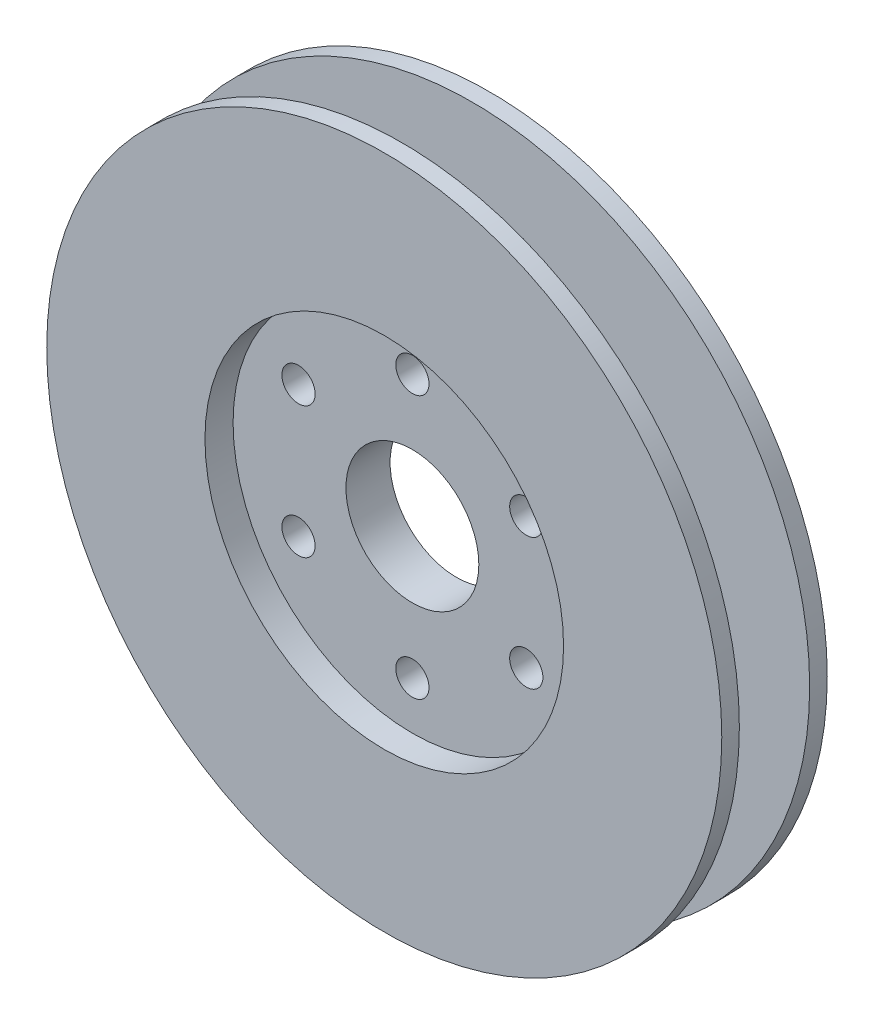
from build123d import *

# Parameters (mm, degrees)
SKETCH1_R             = 60.96
BOSS_EXTRUDE1_DEPTH   = 19.05
SKETCH2_R             = 12
CUT_EXTRUDE1_DEPTH    = 89.290122324
SKETCH3_R             = 32.385
CUT_EXTRUDE2_DEPTH    = 5.08
SKETCH4_R             = 28.4
CUT_EXTRUDE3_DEPTH    = 6
F_6_0MM_DOWEL_HOLE1_D = 6


with BuildPart() as part:
    # Sketch1 → Boss-Extrude1 (new body)
    with BuildSketch(Plane.XY):
        Circle(SKETCH1_R)
    extrude(amount=BOSS_EXTRUDE1_DEPTH)

    # Sketch2 → Cut-Extrude1 (cut, through all)
    with BuildSketch(Plane.XY.offset(19.05)):
        Circle(SKETCH2_R)
    extrude(amount=-CUT_EXTRUDE1_DEPTH, mode=Mode.SUBTRACT)

    # Sketch3 → Cut-Extrude2 (cut)
    with BuildSketch(Plane.XY.offset(19.05)):
        Circle(SKETCH3_R)
    extrude(amount=-CUT_EXTRUDE2_DEPTH, mode=Mode.SUBTRACT)

    # Sketch4 → Cut-Extrude3 (cut)
    with BuildSketch(Plane(origin=(0, 0, 0), x_dir=(-1, 0, 0), z_dir=(0, 0, -1))):
        Circle(SKETCH4_R)
    extrude(amount=-CUT_EXTRUDE3_DEPTH, mode=Mode.SUBTRACT)

    # Ø6.0mm Dowel Hole1 (through all)
    with Locations(Plane(origin=(0, 0, 6), x_dir=(-1, 0, 0), z_dir=(0, 0, -1))):
        with Locations((0, 23.75), (20.56810334, 11.875), (20.56810334, -11.875), (0, -23.75), (-20.56810334, 11.875), (-20.56810334, -11.875)):
            Hole(F_6_0MM_DOWEL_HOLE1_D / 2)

    # Sketch12 → Cut-Revolve1 (revolve, cut)
    with BuildSketch(Plane(origin=(0, 0, 0), x_dir=(0, 0, -1), z_dir=(1, 0, 0))):
        Polygon((-3.175, 60.96), (-15.875, 60.96), (-15.875, 48.26), (-15.875, 41.91), (-3.175, 41.91), (-3.175, 48.26), align=None)
    revolve(axis=Axis((0, 0, 0), (0, 0, 1)), mode=Mode.SUBTRACT)


solid = part.part
